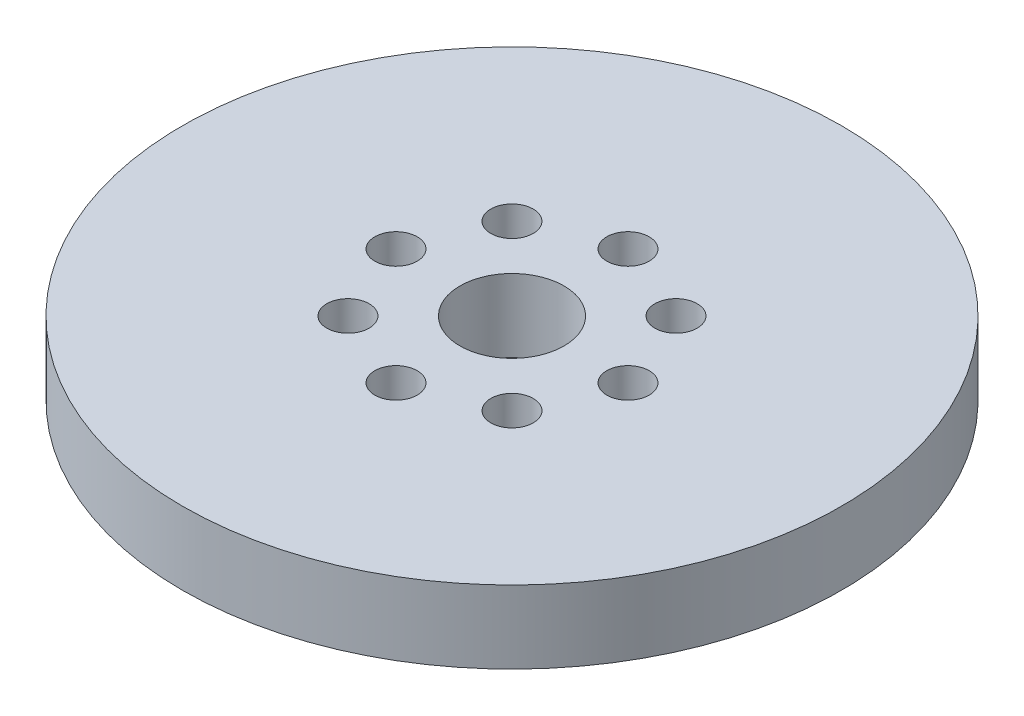
from build123d import *

# Parameters (mm, degrees)
SKETCH1_R           = 95
BOSS_EXTRUDE1_DEPTH = 21
SKETCH2_R           = 15
CUT_EXTRUDE1_DEPTH  = 136.981616405
SKETCH3_R           = 6.111589818
CUT_EXTRUDE2_DEPTH  = 14.639500916
CIRPATTERN1_COUNT   = 8


with BuildPart() as part:
    # Sketch1 → Boss-Extrude1 (new body)
    with BuildSketch(Plane(origin=(0, 0, 0), x_dir=(1, 0, 0), z_dir=(0, 1, 0))):
        Circle(SKETCH1_R)
    extrude(amount=BOSS_EXTRUDE1_DEPTH)

    # Sketch2 → Cut-Extrude1 (cut, through all)
    with BuildSketch(Plane(origin=(0, 0, 0), x_dir=(1, 0, 0), z_dir=(0, 1, 0))):
        Circle(SKETCH2_R)
    extrude(amount=CUT_EXTRUDE1_DEPTH, mode=Mode.SUBTRACT)

    # Sketch3 → Cut-Extrude2 (cut)
    with BuildSketch(Plane(origin=(0, 21, 0), x_dir=(1, 0, 0), z_dir=(0, 1, 0))):
        with Locations((-33.435269409, 0)):
            Circle(SKETCH3_R)
    cut_extrude2 = extrude(amount=-CUT_EXTRUDE2_DEPTH, mode=Mode.SUBTRACT)

    # CirPattern1: Cut-Extrude2 ×8 about axis
    cirpattern1_axis = Axis((0, 0, 0), (0, 1, 0))
    for i in range(1, CIRPATTERN1_COUNT):
        add(cut_extrude2.rotate(cirpattern1_axis, i * 360 / CIRPATTERN1_COUNT), mode=Mode.SUBTRACT)


solid = part.part
